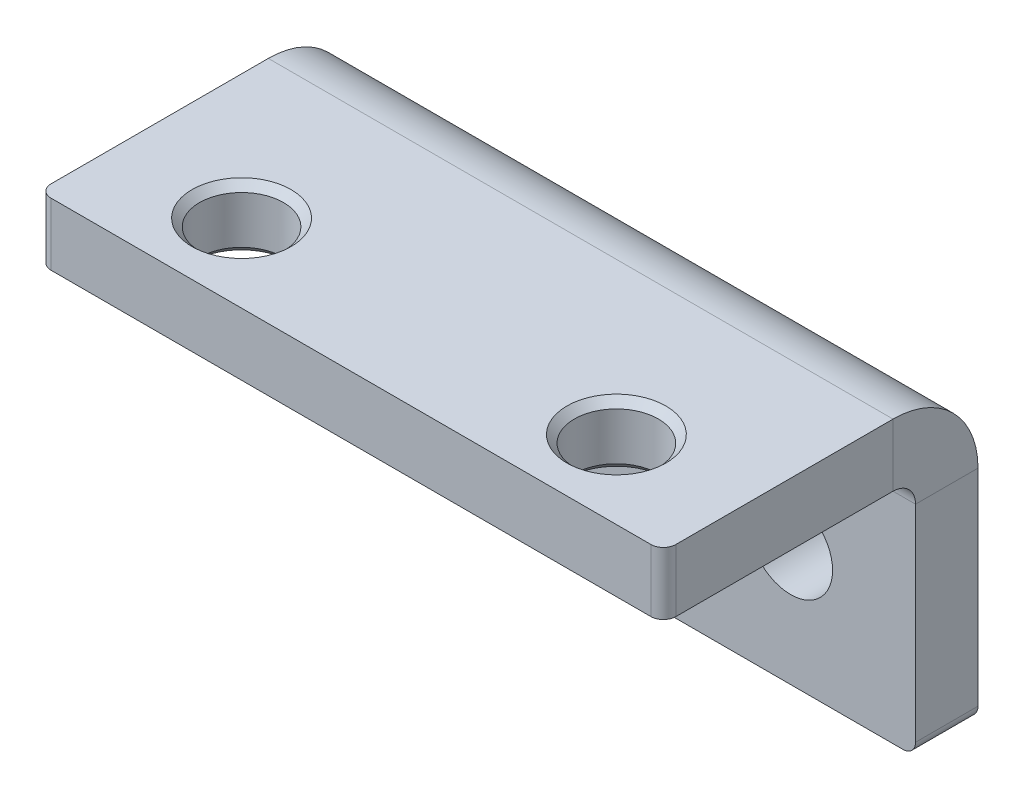
from build123d import *

# Parameters (mm, degrees)
SKETCH1_W                  = 31.75
SKETCH1_H                  = 26.9748
SKETCH1_R                  = 2.1336
BASE_FLANGE1_DEPTH         = 3.175
SKETCHED_START             = 9.335343098
SKETCHED_BEND1_OUTLINE_W   = 31.75
SKETCHED_BEND1_OUTLINE_H   = 3.175
SKETCHED_BEND1_DEPTH       = 11.543456902
SKETCHED_START_2           = 6.160343098
SKETCHED_BEND1_2_OUTLINE_W = 31.75
SKETCHED_BEND1_2_OUTLINE_H = 12.815143098
SKETCHED_BEND1_2_OUTLINE_R = 2.1336
SKETCHED_BEND1_2_DEPTH     = 2.71893284
SKETCHED_START_3           = 5.017343098
SKETCHED_BEND1_3_OUTLINE_W = 31.75
SKETCHED_BEND1_3_OUTLINE_H = 12.815143098
SKETCHED_BEND1_3_OUTLINE_R = 2.1336
SKETCHED_BEND1_3_DEPTH     = 4.318
SKETCHED_START_4           = -15.875
SKETCHED_BEND1_4_DEPTH     = 31.75
CHAMFER1_SIZE              = 0.381
FILLET1_R                  = 0.635


with BuildPart() as part:
    # Base-Flange1: sheet metal written as solids
    # Sketch1 → Base-Flange1 (new body)
    with BuildSketch(Plane.XY):
        with Locations((0, 7.3914)):
            Rectangle(SKETCH1_W, SKETCH1_H)
        with Locations((9.525, 0)):
            Circle(SKETCH1_R, mode=Mode.SUBTRACT)
        with Locations((-9.525, 0)):
            Circle(SKETCH1_R, mode=Mode.SUBTRACT)
        with Locations((9.525, 16.9164)):
            Circle(SKETCH1_R, mode=Mode.SUBTRACT)
        with Locations((-9.525, 16.9164)):
            Circle(SKETCH1_R, mode=Mode.SUBTRACT)
    extrude(amount=BASE_FLANGE1_DEPTH)

    # Sketched Bend1: read off the stored shape, not the designer's step
    # Sketched Bend1 outline → Sketched Bend1 (cut)
    with BuildSketch(Plane(origin=(0, 0, 0), x_dir=(1, 0, 0), z_dir=(0, 1, 0)).offset(SKETCHED_START)):
        with Locations((0, -1.5875)):
            Rectangle(SKETCHED_BEND1_OUTLINE_W, SKETCHED_BEND1_OUTLINE_H)
    extrude(amount=SKETCHED_BEND1_DEPTH, mode=Mode.SUBTRACT)

    # Sketched Bend1 2 outline → Sketched Bend1 2 (add)
    with BuildSketch(Plane(origin=(0, 0, 0), x_dir=(1, 0, 0), z_dir=(0, 1, 0)).offset(SKETCHED_START_2)):
        with Locations((0, -9.582571549)):
            Rectangle(SKETCHED_BEND1_2_OUTLINE_W, SKETCHED_BEND1_2_OUTLINE_H)
        with Locations((-9.525, -12.027743098)):
            Circle(SKETCHED_BEND1_2_OUTLINE_R, mode=Mode.SUBTRACT)
        with Locations((9.525, -12.027743098)):
            Circle(SKETCHED_BEND1_2_OUTLINE_R, mode=Mode.SUBTRACT)
    extrude(amount=SKETCHED_BEND1_2_DEPTH)

    # Sketched Bend1 3 outline → Sketched Bend1 3 (add)
    with BuildSketch(Plane(origin=(0, 0, 0), x_dir=(1, 0, 0), z_dir=(0, 1, 0)).offset(SKETCHED_START_3)):
        with Locations((0, -9.582571549)):
            Rectangle(SKETCHED_BEND1_3_OUTLINE_W, SKETCHED_BEND1_3_OUTLINE_H)
        with Locations((-9.525, -12.027743098)):
            Circle(SKETCHED_BEND1_3_OUTLINE_R, mode=Mode.SUBTRACT)
        with Locations((9.525, -12.027743098)):
            Circle(SKETCHED_BEND1_3_OUTLINE_R, mode=Mode.SUBTRACT)
    extrude(amount=SKETCHED_BEND1_3_DEPTH)

    # Sketched Bend1 4 outline → Sketched Bend1 4 (cut)
    with BuildSketch(Plane.YZ.offset(SKETCHED_START_4)):
        with BuildLine():
            Line((6.160343098, 4.318), (6.160343098, 15.990143098))
            Line((6.160343098, 15.990143098), (5.017343098, 15.990143098))
            Line((5.017343098, 15.990143098), (5.017343098, 3.175))
            ThreePointArc((5.017343098, 3.175), (5.825566149, 3.509776949), (6.160343098, 4.318))
        make_face()
        with BuildLine():
            Line((9.335343098, 0), (9.335343098, 4.318))
            ThreePointArc((9.335343098, 4.318), (8.070630179, 1.264712919), (5.017343098, 0))
            Line((5.017343098, 0), (9.335343098, 0))
        make_face()
    extrude(amount=SKETCHED_BEND1_4_DEPTH, mode=Mode.SUBTRACT)

    # Chamfer1
    chamfer1_edges = [part.edges().sort_by_distance(p)[0] for p in [
        (7.3914, 9.335343098, 12.027743098),
        (7.3914, 6.160343098, 12.027743098),
        (-11.6586, 9.335343098, 12.027743098),
        (-11.6586, 6.160343098, 12.027743098),
    ]]
    chamfer(chamfer1_edges, length=CHAMFER1_SIZE)

    # Fillet1
    fillet1_edges = [part.edges().sort_by_distance(p)[0] for p in [
        (-15.875, -6.096, 1.5875),
        (15.875, -6.096, 1.5875),
        (-15.875, 7.747843098, 15.990143098),
        (15.875, 7.747843098, 15.990143098),
    ]]
    fillet(fillet1_edges, radius=FILLET1_R)


solid = part.part
